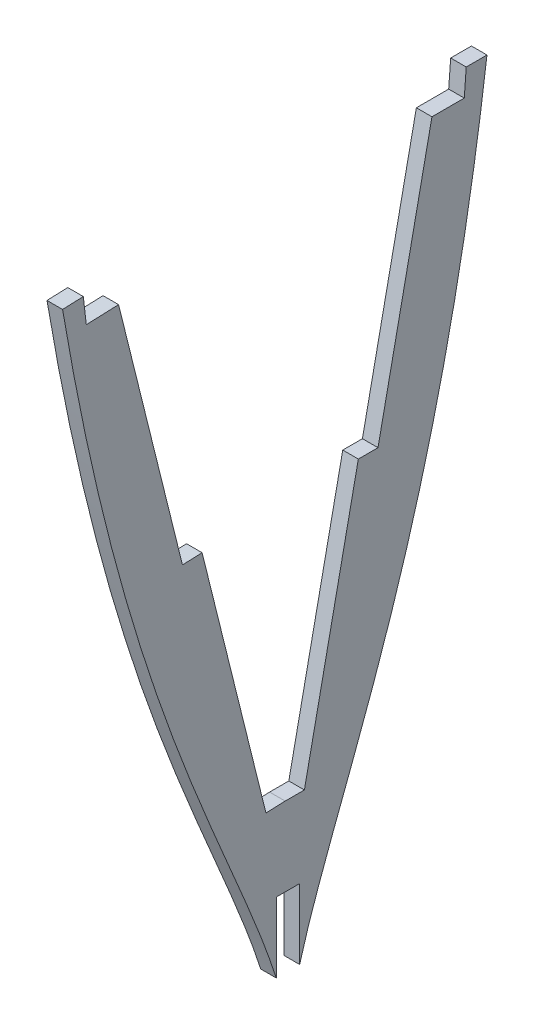
from build123d import *

# Parameters (mm, degrees)
BOSS_EXTRU_3_DEPTH      = 6
ENL_V_MAT_EXTRU_1_DEPTH = 6


with BuildPart() as part:
    # Esquisse2 → Boss.-Extru.3 (new body)
    with BuildSketch(Plane(origin=(0, 0, 0), x_dir=(0, 0, -1), z_dir=(1, 0, 0))):
        with BuildLine():
            Line((74.618394642, 374.988860425), (66.620276508, 374.988860425))
            Line((66.620276508, 374.988860425), (65.857304168, 364.988860425))
            Line((65.857304168, 364.988860425), (53.409489087, 364.988860425))
            Line((53.409489087, 364.988860425), (32.632975645, 264.988860425))
            Line((32.632975645, 264.988860425), (25.05767431, 264.988860425))
            Line((25.05767431, 264.988860425), (4.281160868, 164.988860425))
            Line((4.281160868, 164.988860425), (-3.124683809, 164.988860425))
            Line((-3.124683809, 164.988860425), (-10.525079973, 164.704832246))
            Line((-10.525079973, 164.704832246), (-35.121497553, 263.834443125))
            Line((-35.121497553, 263.834443125), (-42.691225704, 263.543915963))
            Line((-42.691225704, 263.543915963), (-67.287643284, 362.673526842))
            Line((-67.287643284, 362.673526842), (-79.726300451, 362.196129543))
            Line((-79.726300451, 362.196129543), (-80.872230419, 372.159511063))
            Line((-80.872230419, 372.159511063), (-88.864464301, 371.852768075))
            add(Edge.make_bspline(
                [(-88.864464301, 371.852768075), (-60.019522408, 201.464161689), (-14.22678275, 148.31608134), (-1.678548323, 89.602571591)],
                knots=[0, 0, 0, 0, 1, 1, 1, 1], degree=3))
            add(Edge.make_bspline(
                [(74.618394642, 374.988860425), (52.329400068, 203.619351527), (8.608679942, 148.754134114), (-1.678548323, 89.602571591)],
                knots=[0, 0, 0, 0, 1, 1, 1, 1], degree=3))
        make_face()
    extrude(amount=BOSS_EXTRU_3_DEPTH)

    # Esquisse3 → Enlèv. mat.-Extru.1 (cut)
    with BuildSketch(Plane(origin=(6, 0, 0), x_dir=(0, 0, -1), z_dir=(1, 0, 0))):
        Polygon((-6.551065321, 107.676782508), (-6.551065321, 134.676782508), (2.448934679, 134.676782508), (2.448934679, 107.676782508), (29.690319749, 86.957279117), (-22.562762959, 86.957279117), align=None)
    extrude(amount=-ENL_V_MAT_EXTRU_1_DEPTH, mode=Mode.SUBTRACT)


solid = part.part
